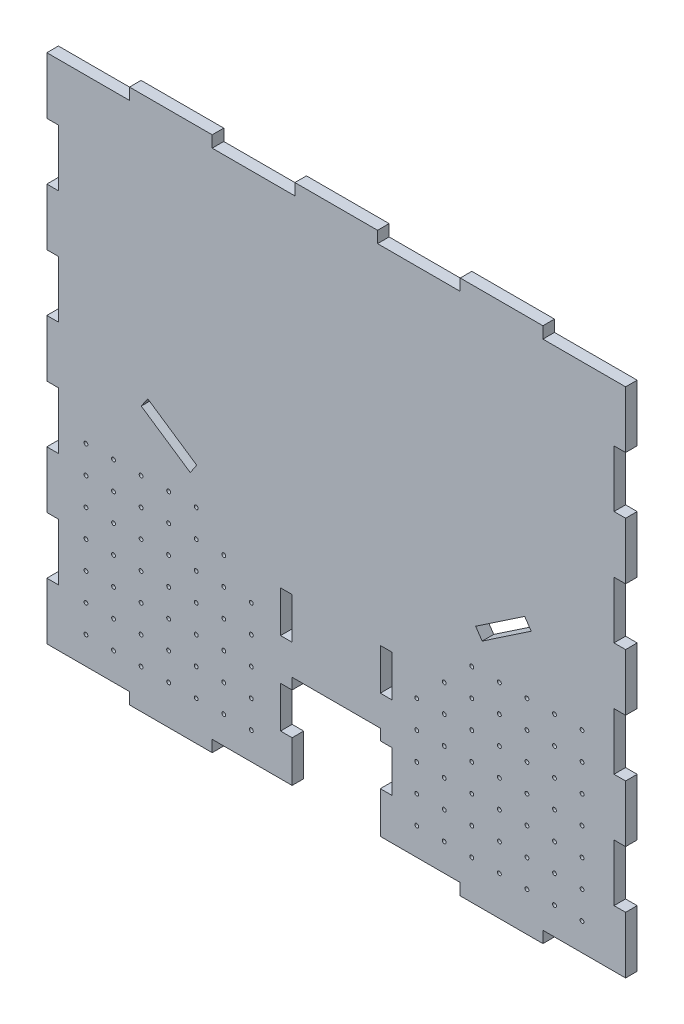
from build123d import *

# Parameters (mm, degrees)
SKETCH1_W           = 266.7
SKETCH1_H           = 246.5832
BOSS_EXTRUDE1_DEPTH = 5.334
SKETCH3_W           = 38.1
SKETCH3_H           = 5.334
CUT_EXTRUDE1_DEPTH  = 326.142186061
SKETCH4_W           = 5.334
SKETCH4_H           = 19.05
CUT_EXTRUDE2_DEPTH  = 326.142186061
SKETCH5_W           = 5.334
SKETCH5_H           = 26.2128
CUT_EXTRUDE3_DEPTH  = 326.142186061
SKETCH6_R           = 0.889
CUT_EXTRUDE4_DEPTH  = 326.142186061
SKETCH7_W           = 40.64
SKETCH7_H           = 48.514
CUT_EXTRUDE5_DEPTH  = 326.142186061


with BuildPart() as part:
    # Sketch1 → Boss-Extrude1 (new body)
    with BuildSketch(Plane.XY):
        with Locations((-107.591743392, 94.965280514)):
            Rectangle(SKETCH1_W, SKETCH1_H)
    extrude(amount=BOSS_EXTRUDE1_DEPTH)

    # Sketch3 → Cut-Extrude1 (cut, through all)
    with BuildSketch(Plane.XY.offset(5.334)):
        with Locations((-221.891743392, 215.589880514)):
            Rectangle(SKETCH3_W, SKETCH3_H)
        with Locations((-145.691743392, 215.589880514)):
            Rectangle(SKETCH3_W, SKETCH3_H)
        with Locations((-69.491743392, 215.589880514)):
            Rectangle(SKETCH3_W, SKETCH3_H)
        with Locations((6.708256608, 215.589880514)):
            Rectangle(SKETCH3_W, SKETCH3_H)
        with Locations((6.708256608, -25.659319486)):
            Rectangle(SKETCH3_W, SKETCH3_H)
        with Locations((-69.491743392, -25.659319486)):
            Rectangle(SKETCH3_W, SKETCH3_H)
        with Locations((-145.691743392, -25.659319486)):
            Rectangle(SKETCH3_W, SKETCH3_H)
        with Locations((-221.891743392, -25.659319486)):
            Rectangle(SKETCH3_W, SKETCH3_H)
    extrude(amount=-CUT_EXTRUDE1_DEPTH, mode=Mode.SUBTRACT)

    # Sketch4 → Cut-Extrude2 (cut, through all)
    with BuildSketch(Plane.XY.offset(5.334)):
        with Locations((-130.578743392, 43.682680514)):
            Rectangle(SKETCH4_W, SKETCH4_H)
        with Locations((-130.578743392, 5.582680514)):
            Rectangle(SKETCH4_W, SKETCH4_H)
        Polygon((-171.865942861, 82.839725101), (-174.8476101, 78.416918697), (-197.436239811, 93.645208391), (-194.454572573, 98.068014794), align=None)
        Polygon((-20.72891421, 98.068014794), (-17.747246972, 93.645208391), (-40.335876684, 78.416918697), (-43.317543922, 82.839725101), align=None)
        with Locations((-84.604743392, 5.582680514)):
            Rectangle(SKETCH4_W, SKETCH4_H)
        with Locations((-84.604743392, 43.682680514)):
            Rectangle(SKETCH4_W, SKETCH4_H)
    extrude(amount=-CUT_EXTRUDE2_DEPTH, mode=Mode.SUBTRACT)

    # Sketch5 → Cut-Extrude3 (cut, through all)
    with BuildSketch(Plane.XY.offset(5.334)):
        with Locations((-238.274743392, 173.603680514)):
            Rectangle(SKETCH5_W, SKETCH5_H)
        with Locations((-238.274743392, 121.178080514)):
            Rectangle(SKETCH5_W, SKETCH5_H)
        with Locations((-238.274743392, 68.752480514)):
            Rectangle(SKETCH5_W, SKETCH5_H)
        with Locations((-238.274743392, 16.326880514)):
            Rectangle(SKETCH5_W, SKETCH5_H)
        with Locations((23.091256608, 16.326880514)):
            Rectangle(SKETCH5_W, SKETCH5_H)
        with Locations((23.091256608, 68.752480514)):
            Rectangle(SKETCH5_W, SKETCH5_H)
        with Locations((23.091256608, 121.178080514)):
            Rectangle(SKETCH5_W, SKETCH5_H)
        with Locations((23.091256608, 173.603680514)):
            Rectangle(SKETCH5_W, SKETCH5_H)
    extrude(amount=-CUT_EXTRUDE3_DEPTH, mode=Mode.SUBTRACT)

    # Sketch6 → Cut-Extrude4 (cut, through all)
    with BuildSketch(Plane.XY.offset(5.334)):
        with Locations((-222.907743392, -10.292319486)):
            Circle(SKETCH6_R)
        with Locations((-210.207743392, -10.292319486)):
            Circle(SKETCH6_R)
        with Locations((-197.507743392, -10.292319486)):
            Circle(SKETCH6_R)
        with Locations((-184.807743392, -10.292319486)):
            Circle(SKETCH6_R)
        with Locations((-172.107743392, -10.292319486)):
            Circle(SKETCH6_R)
        with Locations((-159.407743392, -10.292319486)):
            Circle(SKETCH6_R)
        with Locations((-146.707743392, -10.292319486)):
            Circle(SKETCH6_R)
        with Locations((-70.507743392, -10.292319486)):
            Circle(SKETCH6_R)
        with Locations((-57.807743392, -10.292319486)):
            Circle(SKETCH6_R)
        with Locations((-45.107743392, -10.292319486)):
            Circle(SKETCH6_R)
        with Locations((-32.407743392, -10.292319486)):
            Circle(SKETCH6_R)
        with Locations((-19.707743392, -10.292319486)):
            Circle(SKETCH6_R)
        with Locations((-7.007743392, -10.292319486)):
            Circle(SKETCH6_R)
        with Locations((5.692256608, -10.292319486)):
            Circle(SKETCH6_R)
        with Locations((-210.207743392, 2.407680514)):
            Circle(SKETCH6_R)
        with Locations((-197.507743392, 2.407680514)):
            Circle(SKETCH6_R)
        with Locations((-184.807743392, 2.407680514)):
            Circle(SKETCH6_R)
        with Locations((-172.107743392, 2.407680514)):
            Circle(SKETCH6_R)
        with Locations((-159.407743392, 2.407680514)):
            Circle(SKETCH6_R)
        with Locations((-146.707743392, 2.407680514)):
            Circle(SKETCH6_R)
        with Locations((-70.507743392, 2.407680514)):
            Circle(SKETCH6_R)
        with Locations((-57.807743392, 2.407680514)):
            Circle(SKETCH6_R)
        with Locations((-45.107743392, 2.407680514)):
            Circle(SKETCH6_R)
        with Locations((-32.407743392, 2.407680514)):
            Circle(SKETCH6_R)
        with Locations((-19.707743392, 2.407680514)):
            Circle(SKETCH6_R)
        with Locations((-7.007743392, 2.407680514)):
            Circle(SKETCH6_R)
        with Locations((5.692256608, 2.407680514)):
            Circle(SKETCH6_R)
        with Locations((-210.207743392, 15.107680514)):
            Circle(SKETCH6_R)
        with Locations((-197.507743392, 15.107680514)):
            Circle(SKETCH6_R)
        with Locations((-184.807743392, 15.107680514)):
            Circle(SKETCH6_R)
        with Locations((-172.107743392, 15.107680514)):
            Circle(SKETCH6_R)
        with Locations((-159.407743392, 15.107680514)):
            Circle(SKETCH6_R)
        with Locations((-146.707743392, 15.107680514)):
            Circle(SKETCH6_R)
        with Locations((-70.507743392, 15.107680514)):
            Circle(SKETCH6_R)
        with Locations((-57.807743392, 15.107680514)):
            Circle(SKETCH6_R)
        with Locations((-45.107743392, 15.107680514)):
            Circle(SKETCH6_R)
        with Locations((-32.407743392, 15.107680514)):
            Circle(SKETCH6_R)
        with Locations((-19.707743392, 15.107680514)):
            Circle(SKETCH6_R)
        with Locations((-7.007743392, 15.107680514)):
            Circle(SKETCH6_R)
        with Locations((5.692256608, 15.107680514)):
            Circle(SKETCH6_R)
        with Locations((-210.207743392, 27.807680514)):
            Circle(SKETCH6_R)
        with Locations((-197.507743392, 27.807680514)):
            Circle(SKETCH6_R)
        with Locations((-184.807743392, 27.807680514)):
            Circle(SKETCH6_R)
        with Locations((-172.107743392, 27.807680514)):
            Circle(SKETCH6_R)
        with Locations((-159.407743392, 27.807680514)):
            Circle(SKETCH6_R)
        with Locations((-146.707743392, 27.807680514)):
            Circle(SKETCH6_R)
        with Locations((-70.507743392, 27.807680514)):
            Circle(SKETCH6_R)
        with Locations((-57.807743392, 27.807680514)):
            Circle(SKETCH6_R)
        with Locations((-45.107743392, 27.807680514)):
            Circle(SKETCH6_R)
        with Locations((-32.407743392, 27.807680514)):
            Circle(SKETCH6_R)
        with Locations((-19.707743392, 27.807680514)):
            Circle(SKETCH6_R)
        with Locations((-7.007743392, 27.807680514)):
            Circle(SKETCH6_R)
        with Locations((5.692256608, 27.807680514)):
            Circle(SKETCH6_R)
        with Locations((-210.207743392, 40.507680514)):
            Circle(SKETCH6_R)
        with Locations((-197.507743392, 40.507680514)):
            Circle(SKETCH6_R)
        with Locations((-184.807743392, 40.507680514)):
            Circle(SKETCH6_R)
        with Locations((-172.107743392, 40.507680514)):
            Circle(SKETCH6_R)
        with Locations((-159.407743392, 40.507680514)):
            Circle(SKETCH6_R)
        with Locations((-146.707743392, 40.507680514)):
            Circle(SKETCH6_R)
        with Locations((-70.507743392, 40.507680514)):
            Circle(SKETCH6_R)
        with Locations((-57.807743392, 40.507680514)):
            Circle(SKETCH6_R)
        with Locations((-45.107743392, 40.507680514)):
            Circle(SKETCH6_R)
        with Locations((-32.407743392, 40.507680514)):
            Circle(SKETCH6_R)
        with Locations((-19.707743392, 40.507680514)):
            Circle(SKETCH6_R)
        with Locations((-7.007743392, 40.507680514)):
            Circle(SKETCH6_R)
        with Locations((5.692256608, 40.507680514)):
            Circle(SKETCH6_R)
        with Locations((-210.207743392, 53.207680514)):
            Circle(SKETCH6_R)
        with Locations((-197.507743392, 53.207680514)):
            Circle(SKETCH6_R)
        with Locations((-184.807743392, 53.207680514)):
            Circle(SKETCH6_R)
        with Locations((-172.107743392, 53.207680514)):
            Circle(SKETCH6_R)
        with Locations((-159.407743392, 53.207680514)):
            Circle(SKETCH6_R)
        with Locations((-57.807743392, 53.207680514)):
            Circle(SKETCH6_R)
        with Locations((-45.107743392, 53.207680514)):
            Circle(SKETCH6_R)
        with Locations((-32.407743392, 53.207680514)):
            Circle(SKETCH6_R)
        with Locations((-19.707743392, 53.207680514)):
            Circle(SKETCH6_R)
        with Locations((-7.007743392, 53.207680514)):
            Circle(SKETCH6_R)
        with Locations((5.692256608, 53.207680514)):
            Circle(SKETCH6_R)
        with Locations((-210.207743392, 65.907680514)):
            Circle(SKETCH6_R)
        with Locations((-197.507743392, 65.907680514)):
            Circle(SKETCH6_R)
        with Locations((-184.807743392, 65.907680514)):
            Circle(SKETCH6_R)
        with Locations((-172.107743392, 65.907680514)):
            Circle(SKETCH6_R)
        with Locations((-45.107743392, 65.907680514)):
            Circle(SKETCH6_R)
        with Locations((-32.407743392, 65.907680514)):
            Circle(SKETCH6_R)
        with Locations((-19.707743392, 65.907680514)):
            Circle(SKETCH6_R)
        with Locations((-7.007743392, 65.907680514)):
            Circle(SKETCH6_R)
        with Locations((5.692256608, 65.907680514)):
            Circle(SKETCH6_R)
        with Locations((-222.907743392, 2.407680514)):
            Circle(SKETCH6_R)
        with Locations((-222.907743392, 15.107680514)):
            Circle(SKETCH6_R)
        with Locations((-222.907743392, 27.807680514)):
            Circle(SKETCH6_R)
        with Locations((-222.907743392, 40.507680514)):
            Circle(SKETCH6_R)
        with Locations((-222.907743392, 53.207680514)):
            Circle(SKETCH6_R)
        with Locations((-222.907743392, 65.907680514)):
            Circle(SKETCH6_R)
    extrude(amount=-CUT_EXTRUDE4_DEPTH, mode=Mode.SUBTRACT)

    # Sketch7 → Cut-Extrude5 (cut, through all)
    with BuildSketch(Plane.XY.offset(5.334)):
        with Locations((-107.591743392, -4.069319486)):
            Rectangle(SKETCH7_W, SKETCH7_H)
    extrude(amount=-CUT_EXTRUDE5_DEPTH, mode=Mode.SUBTRACT)


solid = part.part
